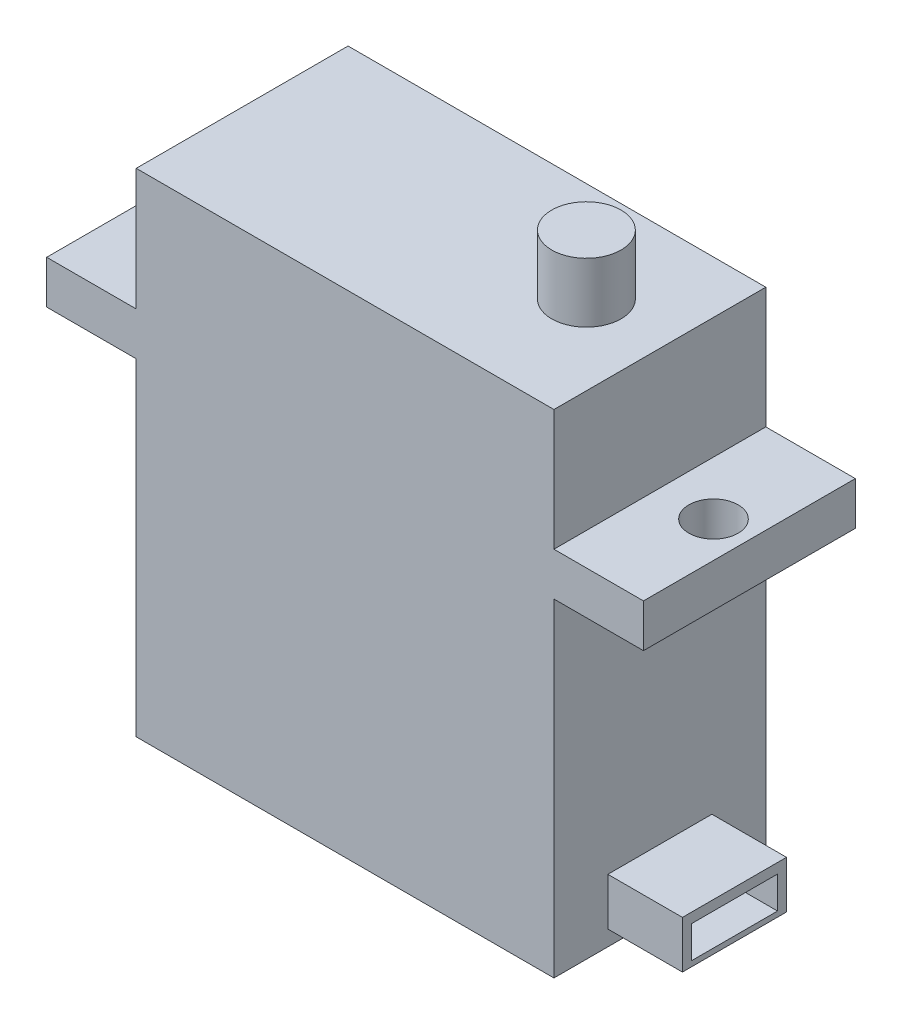
from build123d import *

# Parameters (mm, degrees)
SKETCH1_W           = 28
SKETCH1_H           = 14.2
BOSS_EXTRUDE1_DEPTH = 33
SKETCH2_R           = 2.321908149
BOSS_EXTRUDE3_DEPTH = 4
SKETCH3_W           = 6.974752534
SKETCH3_H           = 3.176308394
BOSS_EXTRUDE4_DEPTH = 5
SKETCH4_W           = 5.77752576
SKETCH4_H           = 2.149777027
CUT_EXTRUDE1_DEPTH  = 5
SKETCH6_W           = 14.2
SKETCH6_H           = 2.892759627
BOSS_EXTRUDE5_DEPTH = 6
SKETCH11_W          = 14.2
SKETCH11_H          = 2.89
BOSS_EXTRUDE6_DEPTH = 6
SKETCH12_R          = 1.651
CUT_EXTRUDE4_DEPTH  = 6
SKETCH17_R          = 1.651
CUT_EXTRUDE5_DEPTH  = 45.435355427


with BuildPart() as part:
    # Sketch1 → Boss-Extrude1 (new body)
    with BuildSketch(Plane(origin=(0, 0, 0), x_dir=(1, 0, 0), z_dir=(0, 1, 0))):
        with Locations((-14, 7.1)):
            Rectangle(SKETCH1_W, SKETCH1_H)
    extrude(amount=BOSS_EXTRUDE1_DEPTH)

    # Sketch2 → Boss-Extrude3 (add)
    with BuildSketch(Plane(origin=(0, 33, 0), x_dir=(1, 0, 0), z_dir=(0, 1, 0))):
        with Locations((-5.331542912, 7.506333926)):
            Circle(SKETCH2_R)
    extrude(amount=BOSS_EXTRUDE3_DEPTH)

    # Sketch3 → Boss-Extrude4 (add)
    with BuildSketch(Plane(origin=(0, 0, 0), x_dir=(0, 0, -1), z_dir=(1, 0, 0))):
        with Locations((7.1, 2.624490745)):
            Rectangle(SKETCH3_W, SKETCH3_H)
    extrude(amount=BOSS_EXTRUDE4_DEPTH)

    # Sketch4 → Cut-Extrude1 (cut)
    with BuildSketch(Plane(origin=(5, 0, 0), x_dir=(0, 0, -1), z_dir=(1, 0, 0))):
        with Locations((7.1, 2.467865933)):
            Rectangle(SKETCH4_W, SKETCH4_H)
    extrude(amount=-CUT_EXTRUDE1_DEPTH, mode=Mode.SUBTRACT)

    # Sketch6 → Boss-Extrude5 (add)
    with BuildSketch(Plane.ZY.offset(28)):
        with Locations((-7.1, 23.390302975)):
            Rectangle(SKETCH6_W, SKETCH6_H)
    extrude(amount=BOSS_EXTRUDE5_DEPTH)

    # Sketch11 → Boss-Extrude6 (add)
    with BuildSketch(Plane(origin=(0, 0, 0), x_dir=(0, 0, -1), z_dir=(1, 0, 0))):
        with Locations((7.1, 23.445)):
            Rectangle(SKETCH11_W, SKETCH11_H)
    extrude(amount=BOSS_EXTRUDE6_DEPTH)

    # Sketch12 → Cut-Extrude4 (cut)
    with BuildSketch(Plane(origin=(0, 24.89, 0), x_dir=(1, 0, 0), z_dir=(0, 1, 0))):
        with Locations((3.594494482, 7.1)):
            Circle(SKETCH12_R)
    extrude(amount=-CUT_EXTRUDE4_DEPTH, mode=Mode.SUBTRACT)

    # Sketch17 → Cut-Extrude5 (cut, through all)
    with BuildSketch(Plane(origin=(0, 24.836682788, 0), x_dir=(1, 0, 0), z_dir=(0, 1, 0))):
        with Locations((-31.335208853, 7.1)):
            Circle(SKETCH17_R)
    extrude(amount=-CUT_EXTRUDE5_DEPTH, mode=Mode.SUBTRACT)


solid = part.part
